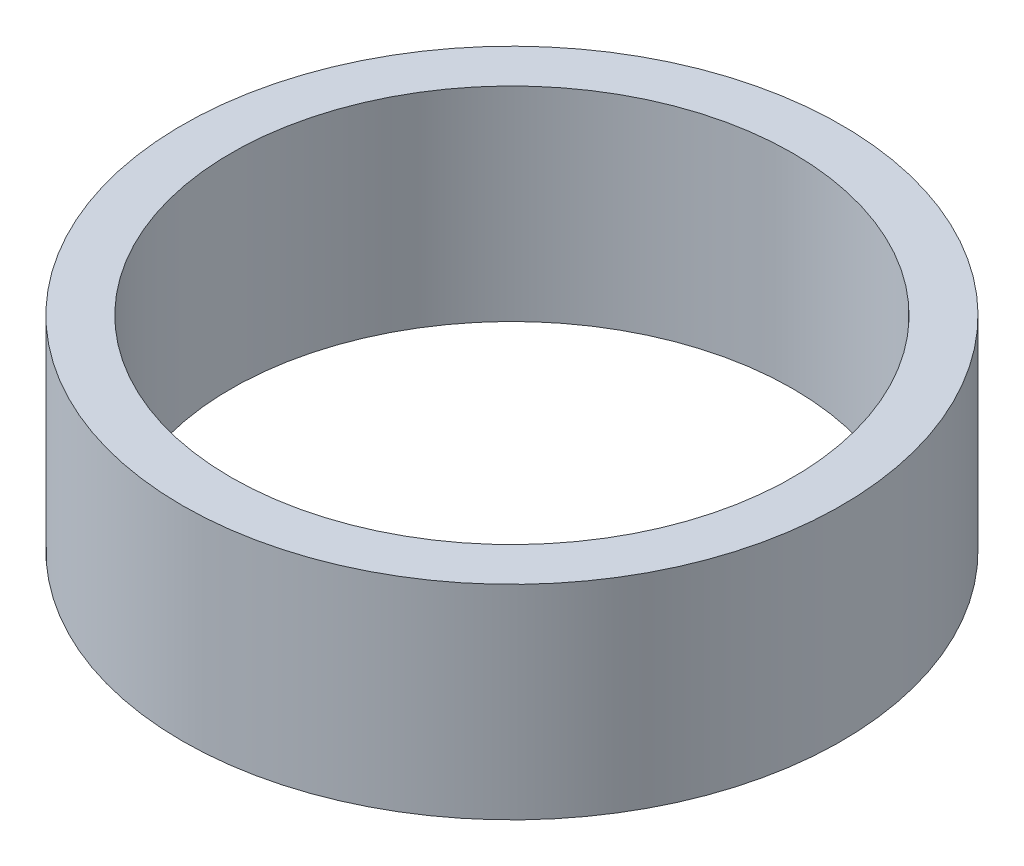
from build123d import *

# Parameters (mm, degrees)
SKETCH1_R           = 35
BOSS_EXTRUDE1_DEPTH = 21.663070552
SKETCH2_R           = 29.825387199
CUT_EXTRUDE1_DEPTH  = 55.030441658


with BuildPart() as part:
    # Sketch1 → Boss-Extrude1 (new body)
    with BuildSketch(Plane(origin=(0, 0, 0), x_dir=(1, 0, 0), z_dir=(0, 1, 0))):
        Circle(SKETCH1_R)
    extrude(amount=BOSS_EXTRUDE1_DEPTH)

    # Sketch2 → Cut-Extrude1 (cut, through all)
    with BuildSketch(Plane(origin=(0, 0, 0), x_dir=(1, 0, 0), z_dir=(0, 1, 0))):
        Circle(SKETCH2_R)
    extrude(amount=CUT_EXTRUDE1_DEPTH, mode=Mode.SUBTRACT)


solid = part.part
